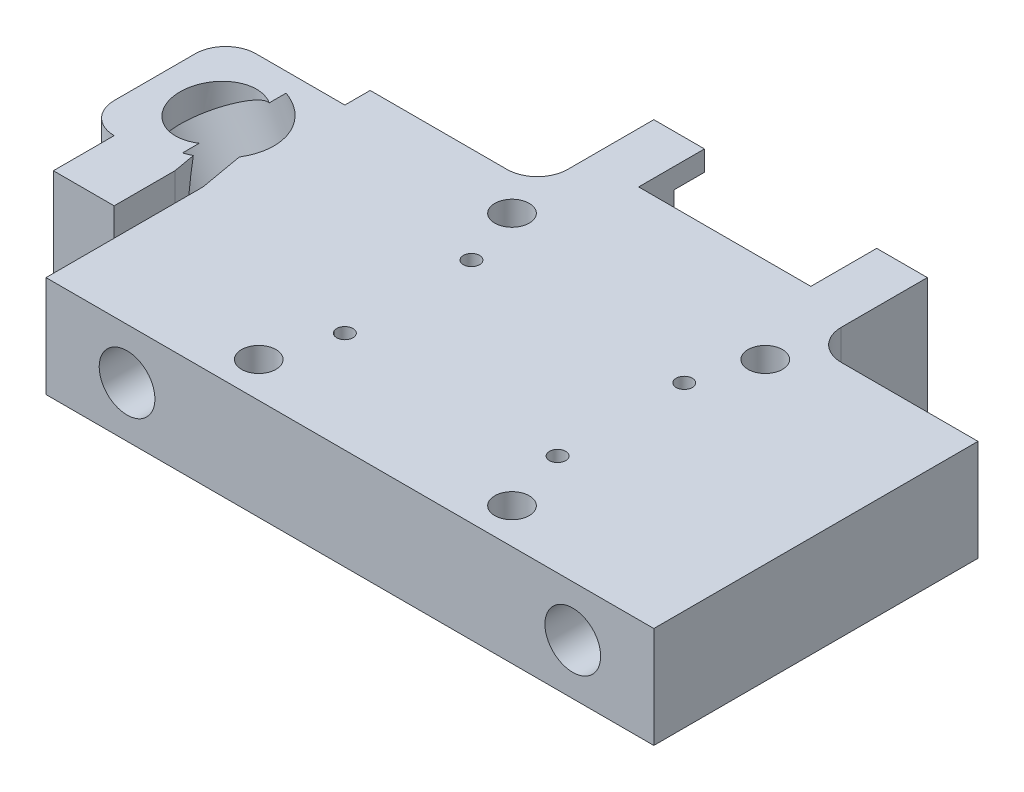
from build123d import *

# Parameters (mm, degrees)
SKETCH2_W                      = 60
SKETCH2_H                      = 32
BOSS_EXTRUDE1_DEPTH            = 10
CBORE_FOR_M3_SHCS1_D           = 3.4
CBORE_FOR_M3_SHCS1_CBORE_D     = 6.5
CBORE_FOR_M3_SHCS1_CBORE_DEPTH = 5
SKETCH6_W                      = 17
SKETCH6_H                      = 12
CUT_EXTRUDE2_DEPTH             = 2
CUT_EXTRUDE4_DEPTH             = 5
M5_CLEARANCE_HOLE1_D           = 5.5
SKETCH12_R                     = 2
BOSS_EXTRUDE2_DEPTH            = 2.5
M2X0_4_TAPPED_HOLE1_D          = 1.6
BOSS_EXTRUDE3_DEPTH            = 5
BOSS_EXTRUDE4_DEPTH            = 6.5
FILLET1_R                      = 4
M2X0_4_TAPPED_HOLE2_D          = 1.6
M2X0_4_TAPPED_HOLE2_DEPTH      = 5.2
M2X0_4_TAPPED_HOLE2_TIP        = 0.480688495
CUT_EXTRUDE5_DEPTH             = 3
CHAMFER1_SIZE                  = 1
BOSS_EXTRUDE5_DEPTH            = 10
SKETCH26_R                     = 5.5
CUT_EXTRUDE7_DEPTH             = 14
SKETCH27_R                     = 4
CUT_EXTRUDE8_DEPTH             = 14
FILLET2_R                      = 3
SKETCH28_W                     = 6
SKETCH28_H                     = 6
BOSS_EXTRUDE6_DEPTH            = 10
CUT_EXTRUDE9_DEPTH             = 52.000867623
CUT_EXTRUDE10_REACH            = 76.738
SKETCH30_R                     = 1.6
SKETCH31_R                     = 1.4
CUT_EXTRUDE11_DEPTH            = 5


with BuildPart() as part:
    # Sketch2 → Boss-Extrude1 (new body)
    with BuildSketch(Plane(origin=(0, 0, 0), x_dir=(1, 0, 0), z_dir=(0, 1, 0))):
        Rectangle(SKETCH2_W, SKETCH2_H)
    extrude(amount=BOSS_EXTRUDE1_DEPTH)

    # CBORE for M3 SHCS1 (through all)
    with Locations(Plane(origin=(0, 0, 0), x_dir=(-1, 0, 0), z_dir=(0, -1, 0))):
        with Locations((12.5, 12.5), (12.5, -12.5), (-12.5, -12.5), (-12.5, 12.5)):
            CounterBoreHole(CBORE_FOR_M3_SHCS1_D / 2, CBORE_FOR_M3_SHCS1_CBORE_D / 2, CBORE_FOR_M3_SHCS1_CBORE_DEPTH)

    # Sketch6 → Cut-Extrude2 (cut)
    with BuildSketch(Plane(origin=(0, 0, 0), x_dir=(-1, 0, 0), z_dir=(0, -1, 0))):
        with Locations((0, 10)):
            Rectangle(SKETCH6_W, SKETCH6_H)
    extrude(amount=-CUT_EXTRUDE2_DEPTH, mode=Mode.SUBTRACT)

    # Sketch8 → Cut-Extrude4 (cut)
    with BuildSketch(Plane(origin=(0, 0, -16), x_dir=(-1, 0, 0), z_dir=(0, 0, -1))):
        Polygon((17.265727793, 5), (19.632863896, 0.9), (24.367136104, 0.9), (26.734272207, 5), (24.367136104, 9.1), (19.632863896, 9.1), align=None)
        Polygon((-17.265727793, 5), (-19.632863896, 9.1), (-24.367136104, 9.1), (-26.734272207, 5), (-24.367136104, 0.9), (-19.632863896, 0.9), align=None)
    extrude(amount=-CUT_EXTRUDE4_DEPTH, mode=Mode.SUBTRACT)

    # M5 Clearance Hole1 (through all)
    with Locations(Plane(origin=(0, 0, -11), x_dir=(-1, 0, 0), z_dir=(0, 0, -1))):
        with Locations((22, 5), (-22, 5)):
            Hole(M5_CLEARANCE_HOLE1_D / 2)

    # Sketch12 → Boss-Extrude2 (add)
    with BuildSketch(Plane.XZ):
        with Locations(Location((10.5, -6.5, 0), (0, 0, 180))):
            Circle(SKETCH12_R)
        with Locations((-10.5, -6.5)):
            Circle(SKETCH12_R)
        with Locations(Location((10.5, 6, 0), (0, 0, 90))):
            Circle(SKETCH12_R)
        with Locations(Location((-10.5, 6, 0), (0, 0, 90))):
            Circle(SKETCH12_R)
    extrude(amount=BOSS_EXTRUDE2_DEPTH)

    # M2x0.4 Tapped Hole1 (through all)
    with Locations(Plane(origin=(0, -2.5, 0), x_dir=(-1, 0, 0), z_dir=(0, -1, 0))):
        with Locations((-10.5, -6), (-10.5, 6.5), (10.5, -6), (10.5, 6.5)):
            Hole(M2X0_4_TAPPED_HOLE1_D / 2)

    # Sketch15 → Boss-Extrude3 (add)
    with BuildSketch(Plane(origin=(0, 0, -16), x_dir=(-1, 0, 0), z_dir=(0, 0, -1))):
        Polygon((-13.5, 0), (-13.5, 10), (13.5, 10), (13.5, 0), (8.5, 0), (8.5, 2), (-8.5, 2), (-8.5, 0), align=None)
    extrude(amount=BOSS_EXTRUDE3_DEPTH)

    # Sketch19 → Boss-Extrude4 (add)
    with BuildSketch(Plane(origin=(0, 0, -21), x_dir=(-1, 0, 0), z_dir=(0, 0, -1))):
        Polygon((13.5, 0), (13.5, -6.7), (8.5, -6.7), (8.5, 0), (8.5, 10), (13.5, 10), align=None)
        Polygon((-8.5, 0), (-8.5, 10), (-13.5, 10), (-13.5, 0), (-13.5, -6.7), (-8.5, -6.7), align=None)
    extrude(amount=BOSS_EXTRUDE4_DEPTH)

    # Fillet1
    fillet1_edges = [part.edges().sort_by_distance(p)[0] for p in [
        (-11, 0, -21),
        (11, 0, -21),
    ]]
    fillet(fillet1_edges, radius=FILLET1_R)

    # M2x0.4 Tapped Hole2
    with Locations(Plane(origin=(0, 0, -27.5), x_dir=(-1, 0, 0), z_dir=(0, 0, -1))):
        with Locations((10.75, -4.7), (-10.75, -4.7), (-10.75, 8), (10.75, 8)):
            Hole(M2X0_4_TAPPED_HOLE2_D / 2, depth=M2X0_4_TAPPED_HOLE2_DEPTH)
            with Locations((0, 0, -(M2X0_4_TAPPED_HOLE2_DEPTH + M2X0_4_TAPPED_HOLE2_TIP / 2))):  # 118° drill point
                Cone(0, M2X0_4_TAPPED_HOLE2_D / 2, M2X0_4_TAPPED_HOLE2_TIP, mode=Mode.SUBTRACT)

    # Sketch23 → Cut-Extrude5 (cut)
    with BuildSketch(Plane(origin=(0, 0, -27.5), x_dir=(-1, 0, 0), z_dir=(0, 0, -1))):
        Polygon((8.5, 8), (11.5, 5), (11.5, -1.7), (8.5, -4.7), (-8.5, -4.7), (-11.5, -1.7), (-11.5, 5), (-8.5, 8), align=None)
    extrude(amount=-CUT_EXTRUDE5_DEPTH, mode=Mode.SUBTRACT)

    # Chamfer1
    # the kernel refuses this chamfer: 1 mm, written as the material it adds along each edge
    with BuildSketch(Plane(origin=(10.5, 0, 6), x_dir=(0, 0, 1), z_dir=(1, 0, 0))) as chamfer1_piece_1:
        Polygon((2 + CHAMFER1_SIZE, 0), (2, CHAMFER1_SIZE), (2, 0), align=None)
    revolve(axis=Axis((10.5, 0, 6), (0, -1, 0)))
    with BuildSketch(Plane(origin=(-10.5, 0, -6.5), x_dir=(1, 0, 0), z_dir=(0, 0, -1))) as chamfer1_piece_2_section:
        Polygon((2 + CHAMFER1_SIZE, 0), (2, CHAMFER1_SIZE), (2, 0), align=None)
    chamfer1_piece_2 = revolve(axis=Axis((-10.5, 0, -6.5), (0, -1, 0)), mode=Mode.PRIVATE)
    chamfer1_piece_2 = split(chamfer1_piece_2, bisect_by=Plane(origin=(-8.5, -0.487052851, -6.5), z_dir=(-1, 0, 0)), keep=Keep.TOP, mode=Mode.PRIVATE)
    add(chamfer1_piece_2)
    with BuildSketch(Plane(origin=(-10.5, 0, 6), x_dir=(0, 0, 1), z_dir=(1, 0, 0))) as chamfer1_piece_3:
        Polygon((2 + CHAMFER1_SIZE, 0), (2, CHAMFER1_SIZE), (2, 0), align=None)
    revolve(axis=Axis((-10.5, 0, 6), (0, -1, 0)))
    with BuildSketch(Plane(origin=(10.5, 0, -6.5), x_dir=(-1, 0, 0), z_dir=(0, 0, 1))) as chamfer1_piece_4_section:
        Polygon((2 + CHAMFER1_SIZE, 0), (2, CHAMFER1_SIZE), (2, 0), align=None)
    chamfer1_piece_4 = revolve(axis=Axis((10.5, 0, -6.5), (0, -1, 0)), mode=Mode.PRIVATE)
    chamfer1_piece_4 = split(chamfer1_piece_4, bisect_by=Plane(origin=(8.5, -0.487052851, -6.5), z_dir=(1, 0, 0)), keep=Keep.TOP, mode=Mode.PRIVATE)
    add(chamfer1_piece_4)

    # Sketch25 → Boss-Extrude5 (add)
    with BuildSketch(Plane.XZ):
        Polygon((-30, 0.5), (-30, -6.5), (-30, -13.5), (-41.771263836, -13.5), (-41.771263836, 0.5), align=None)
    extrude(amount=-BOSS_EXTRUDE5_DEPTH)

    # Sketch26 → Cut-Extrude7 (cut)
    with BuildSketch(Plane(origin=(-34.168169597, -5.889190106, 16), x_dir=(-0.888296712324418, -0.45927001956760705, 0), z_dir=(0.45927001956760705, -0.888296712324418, 0))):
        with Locations(Location((-5.5, 22.5, 0), (0, 0, 180))):
            Circle(SKETCH26_R)
    extrude(amount=-CUT_EXTRUDE7_DEPTH, mode=Mode.SUBTRACT)

    # Sketch27 → Cut-Extrude8 (cut, along a direction that is not the sketch's normal)
    with BuildSketch(Plane(origin=(-11.234235046, 21.728686027, 0), x_dir=(0.888296712324418, 0.45927001956760705, 0), z_dir=(0.45927001956760705, -0.888296712324418, 0))):
        with Locations((-27.556201174, -6.5)):
            Circle(SKETCH27_R)
    extrude(amount=-CUT_EXTRUDE8_DEPTH, dir=(0, -1, 0), mode=Mode.SUBTRACT)

    # Fillet2
    fillet2_edges = [part.edges().sort_by_distance(p)[0] for p in [
        (-13.5, 5, -16),
        (13.5, 5, -16),
        (-41.771263836, 5, 0.5),
        (-41.771263836, 5, -13.5),
    ]]
    fillet(fillet2_edges, radius=FILLET2_R)

    # Sketch28 → Boss-Extrude6 (add)
    with BuildSketch(Plane.XZ):
        with Locations((-35.771263836, 3.5)):
            Rectangle(SKETCH28_W, SKETCH28_H)
    extrude(amount=-BOSS_EXTRUDE6_DEPTH)

    # Sketch29 → Cut-Extrude9 (cut, through all)
    with BuildSketch(Plane.XZ):
        Polygon((-30, 0.5), (-31.125452896, -5.882760545), (-33.813152902, -5.408846518), (-32.771263836, 0.5), align=None)
    extrude(amount=-CUT_EXTRUDE9_DEPTH, mode=Mode.SUBTRACT)

    # Sketch30 → Cut-Extrude10 (cut, up to next)
    with BuildSketch(Plane.ZY.offset(38.771263836), mode=Mode.PRIVATE) as cut_extrude10_sk1:
        with Locations((3.5, 5)):
            Circle(SKETCH30_R)
    cut_extrude10_tool1 = extrude(cut_extrude10_sk1.sketch, amount=-CUT_EXTRUDE10_REACH, mode=Mode.PRIVATE) & part.part
    add(cut_extrude10_tool1.solids().sort_by_distance((-38.771264, 5, 3.5))[0], mode=Mode.SUBTRACT)

    # Sketch31 → Cut-Extrude11 (cut)
    with BuildSketch(Plane.ZY.offset(30)):
        with Locations((3.5, 5)):
            Circle(SKETCH31_R)
    extrude(amount=-CUT_EXTRUDE11_DEPTH, mode=Mode.SUBTRACT)


solid = part.part
